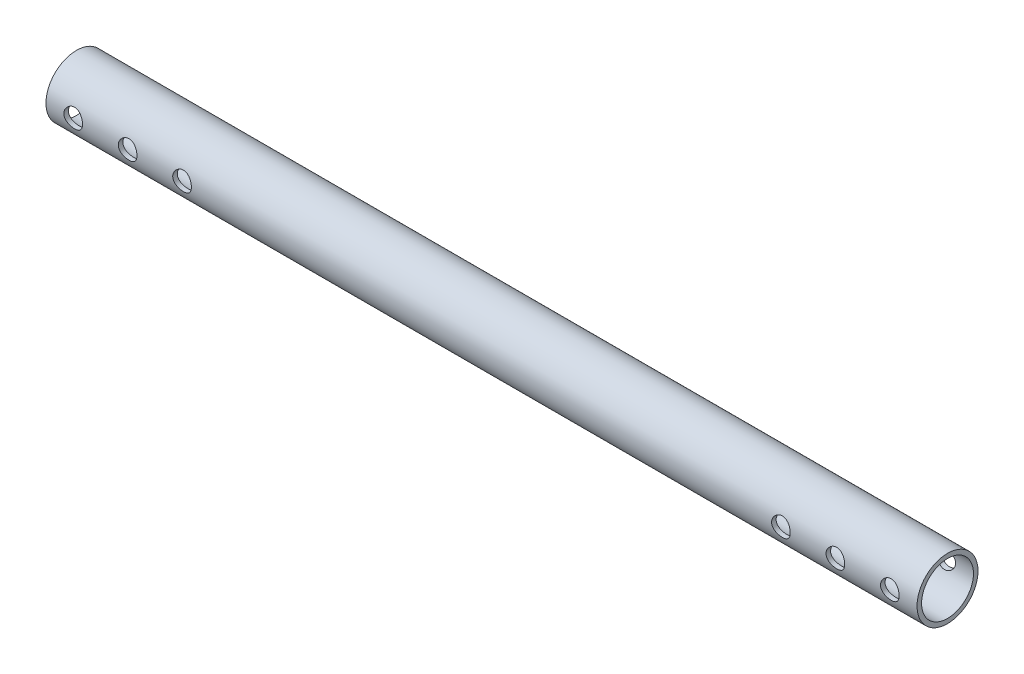
from build123d import *

# Parameters (mm, degrees)
SKETCH1_R               = 10.668
SKETCH1_R_2             = 9.0805
BOSS_EXTRUDE1_DEPTH     = 304.8
CUT_EXTRUDE1_DEPTH      = 306.686133882
CUT_EXTRUDE1_DEPTH_BACK = 306.686133882
SKETCH2_R               = 3.2639


with BuildPart() as part:
    # Sketch1 → Boss-Extrude1 (new body)
    with BuildSketch(Plane(origin=(0, 0, 0), x_dir=(0, 0, -1), z_dir=(1, 0, 0))):
        Circle(SKETCH1_R)
        Circle(SKETCH1_R_2, mode=Mode.SUBTRACT)
    extrude(amount=BOSS_EXTRUDE1_DEPTH)

    # Sketch2 → Cut-Extrude1 (cut, two sides: drawn at the far end of the back side and taken through both)
    with BuildSketch(Plane.XY.offset(10).offset(-CUT_EXTRUDE1_DEPTH_BACK)):
        with Locations((9.525, 0)):
            Circle(SKETCH2_R)
        with Locations((28.575, 0)):
            Circle(SKETCH2_R)
        with Locations((47.625, 0)):
            Circle(SKETCH2_R)
        with Locations((295.275, 0)):
            Circle(SKETCH2_R)
        with Locations((276.225, 0)):
            Circle(SKETCH2_R)
        with Locations((257.175, 0)):
            Circle(SKETCH2_R)
    extrude(amount=CUT_EXTRUDE1_DEPTH + CUT_EXTRUDE1_DEPTH_BACK, mode=Mode.SUBTRACT)


solid = part.part
